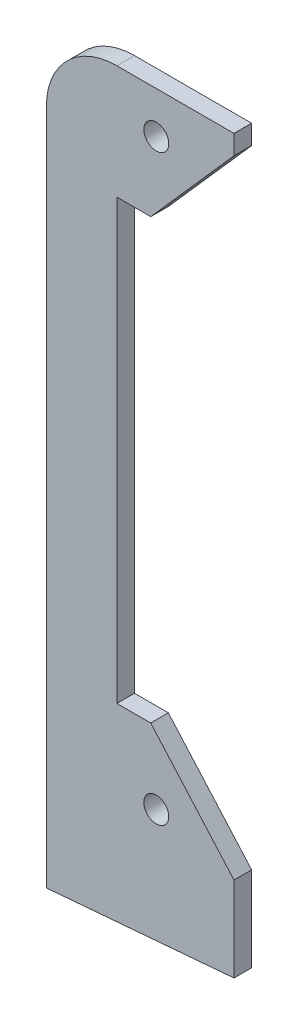
from build123d import *

# Parameters (mm, degrees)
BOSS_EXTRUDE1_DEPTH = 3.175
SKETCH3_R           = 2.25
CUT_EXTRUDE2_DEPTH  = 14.097
FILLET1_R           = 12.7
SKETCH5_W           = 33.799999878
SKETCH5_H           = 3.175
BOSS_EXTRUDE3_DEPTH = 29.083
CUT_EXTRUDE3_DEPTH  = 5.08


with BuildPart() as part:
    # Sketch1 → Boss-Extrude1 (new body)
    with BuildSketch(Plane.XY):
        Polygon((-238.5, 99.5), (-223.5, 116.5), (-223.5, 118), (-223.5, 120), (-257.299999878, 120), (-257.299999878, 118), (-257.299999878, 2), (-250, 2), (-223.5, 2), (-223.5, 3.5), (-238.5, 20.5), (-244.6, 20.5), (-244.6, 99.5), align=None)
    extrude(amount=BOSS_EXTRUDE1_DEPTH)

    # Sketch3 → Cut-Extrude2 (cut)
    with BuildSketch(Plane.XY):
        with Locations((-237.5, 7.5)):
            Circle(SKETCH3_R)
        with Locations((-237.5, 112.5)):
            Circle(SKETCH3_R)
    extrude(amount=CUT_EXTRUDE2_DEPTH, mode=Mode.SUBTRACT)

    # Fillet1
    fillet1_edges = [part.edges().sort_by_distance(p)[0] for p in [
        (-257.299999878, 120, 1.5875),
    ]]
    fillet(fillet1_edges, radius=FILLET1_R)

    # Sketch5 → Boss-Extrude3 (add)
    with BuildSketch(Plane.XZ.offset(-2)):
        with Locations((-240.399999939, 1.5875)):
            Rectangle(SKETCH5_W, SKETCH5_H)
    extrude(amount=BOSS_EXTRUDE3_DEPTH)

    # Sketch6 → Cut-Extrude3 (cut)
    with BuildSketch(Plane.XY.offset(3.175)):
        Polygon((-223.5, -11.7915), (-257.299999878, -14.644916153), (-257.299999878, -27.083), (-223.5, -27.083), align=None)
    extrude(amount=-CUT_EXTRUDE3_DEPTH, mode=Mode.SUBTRACT)


solid = part.part
